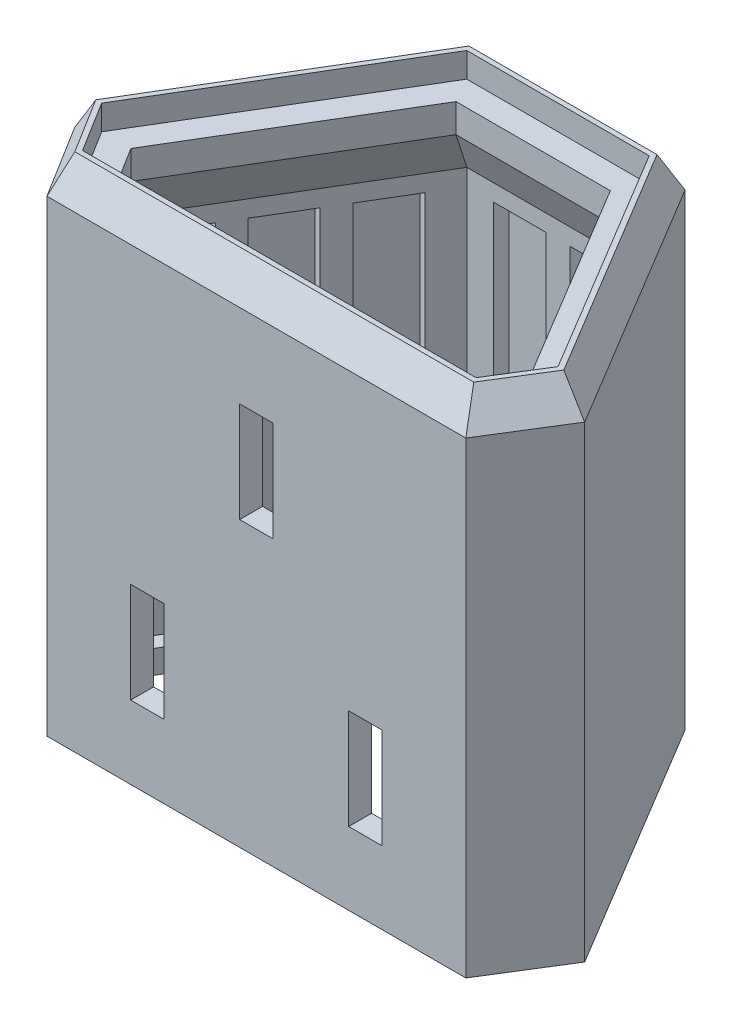
from build123d import *
from OCP.BRepFilletAPI import BRepFilletAPI_MakeChamfer

# Parameters (mm, degrees)
BOSS_EXTRUDE1_DEPTH     = 52.6
BOSS_EXTRUDE2_DEPTH     = 10.6
CUT_EXTRUDE1_DEPTH      = 2.6
CHAMFER1_SIZE           = 4
CHAMFER1_SIZE2          = 2.08
CHAMFER2_SIZE           = 2.6
CHAMFER2_SIZE_2         = 5
SKETCH4_W               = 3.5
SKETCH4_H               = 10.5
CUT_EXTRUDE2_DEPTH      = 10
CUT_EXTRUDE3_DEPTH      = 61
SKETCH7_W               = 5.5
SKETCH7_H               = 37.8
CUT_EXTRUDE4_DEPTH      = 1.6
LPATTERN1_COUNT         = 3
LPATTERN1_PITCH         = 8
LPATTERN1_COL_COUNT     = 3
LPATTERN1_COL_PITCH     = 8
BOSS_EXTRUDE4_DEPTH     = 1.6
SKETCH9_W               = 1.140450815
SKETCH9_H               = 12.988078935
BOSS_EXTRUDE5_DEPTH     = 1.6
BOSS_EXTRUDE6_DEPTH     = 1.6
SKETCH12_W              = 5.5
SKETCH12_H              = 1.257878545
BOSS_EXTRUDE7_DEPTH     = 1.6
SKETCH13_W              = 4.498542915
SKETCH13_H              = 37.8
CUT_EXTRUDE5_DEPTH      = 1.6
SKETCH14_W              = 4.344795522
SKETCH14_H              = 1.255742166
SKETCH14_W_2            = 4.359549185
SKETCH14_H_2            = 1.256348334
BOSS_EXTRUDE8_DEPTH     = 1.6
SKETCH15_W              = 4.5
SKETCH15_H              = 37.8
CUT_EXTRUDE6_DEPTH      = 1.6
SKETCH16_W              = 5.5
SKETCH16_H              = 37.8
CUT_EXTRUDE7_DEPTH      = 1.6
LPATTERN2_COUNT         = 2
LPATTERN2_PITCH         = 8
LPATTERN2_COL_COUNT     = 2
LPATTERN2_COL_PITCH     = 8
MIRROR2_COPY_1_SKETCH_W = 5.5
MIRROR2_COPY_1_SKETCH_H = 37.8
MIRROR2_COPY_1_DEPTH    = 1.6
MIRROR2_COPY_2_SKETCH_W = 5.5
MIRROR2_COPY_2_SKETCH_H = 37.8
MIRROR2_COPY_2_DEPTH    = 1.6
SKETCH17_W              = 5.5
SKETCH17_H              = 37.8
CUT_EXTRUDE8_DEPTH      = 1.6
LPATTERN3_COUNT         = 2
LPATTERN3_PITCH         = 8


with BuildPart() as part:
    # Sketch1 → Boss-Extrude1 (new body)
    with BuildSketch(Plane(origin=(0, 0, 0), x_dir=(1, 0, 0), z_dir=(0, 1, 0))):
        Polygon((-26.953018279, -2.69203799), (-22.055294719, -10.566070483), (22.055294719, -10.566070483), (26.953018279, -2.69203799), (11.028337958, 23.833929517), (-11.028337958, 23.833929517), align=None)
        Polygon((-23.906036559, -2.668005496), (-20.610589438, -7.966070483), (20.610589438, -7.966070483), (23.906036559, -2.668005496), (9.556675916, 21.233929517), (-9.556675916, 21.233929517), align=None, mode=Mode.SUBTRACT)
    extrude(amount=BOSS_EXTRUDE1_DEPTH)

    # Sketch2 → Boss-Extrude2 (add)
    with BuildSketch(Plane(origin=(0, 52.6, 0), x_dir=(1, 0, 0), z_dir=(0, 1, 0))):
        Polygon((-23.906036559, -2.668005496), (-20.610589438, -7.966070483), (20.610589438, -7.966070483), (23.906036559, -2.668005496), (9.556675916, 21.233929517), (-9.556675916, 21.233929517), align=None)
        Polygon((-20.859054838, -2.643973003), (-19.165884157, -5.366070483), (19.165884157, -5.366070483), (20.859054838, -2.643973003), (8.085013874, 18.633929517), (-8.085013874, 18.633929517), align=None, mode=Mode.SUBTRACT)
    extrude(amount=-BOSS_EXTRUDE2_DEPTH)

    # Sketch3 → Cut-Extrude1 (cut)
    with BuildSketch(Plane(origin=(0, 52.6, 0), x_dir=(1, 0, 0), z_dir=(0, 1, 0))):
        Polygon((-23.906036559, -2.668005496), (-20.610589438, -7.966070483), (20.610589438, -7.966070483), (23.906036559, -2.668005496), (9.556675916, 21.233929517), (-9.556675916, 21.233929517), align=None)
        Polygon((-20.859054838, -2.643973003), (-19.165884157, -5.366070483), (19.165884157, -5.366070483), (20.859054838, -2.643973003), (8.085013874, 18.633929517), (-8.085013874, 18.633929517), align=None, mode=Mode.SUBTRACT)
    extrude(amount=-CUT_EXTRUDE1_DEPTH, mode=Mode.SUBTRACT)

    # Chamfer1: one chamfer whose edges measure the first distance from different faces: ONE call of the kernel's chamfer builder (chamfer() names one face for all edges)
    chamfer1_edges_1 = [part.edges().sort_by_distance(p)[0] for p in [
        (-18.990678119, 52.6, -10.570945764),
    ]]
    chamfer1_side_1 = [part.faces().sort_by_distance(p)[0] for p in [
        (-18.990678119, 26.3, -10.570945764),
    ]]
    chamfer1_edges_2 = [part.edges().sort_by_distance(p)[0] for p in [
        (-24.504156499, 52.6, 6.629054236),
    ]]
    chamfer1_side_2 = [part.faces().sort_by_distance(p)[0] for p in [
        (-24.504156499, 26.3, 6.629054236),
    ]]
    chamfer1_edges_3 = [part.edges().sort_by_distance(p)[0] for p in [
        (0, 52.6, 10.566070483),
    ]]
    chamfer1_side_3 = [part.faces().sort_by_distance(p)[0] for p in [
        (0, 26.3, 10.566070483),
    ]]
    chamfer1_edges_4 = [part.edges().sort_by_distance(p)[0] for p in [
        (24.504156499, 52.6, 6.629054236),
    ]]
    chamfer1_side_4 = [part.faces().sort_by_distance(p)[0] for p in [
        (24.504156499, 26.3, 6.629054236),
    ]]
    chamfer1_edges_5 = [part.edges().sort_by_distance(p)[0] for p in [
        (18.990678119, 52.6, -10.570945764),
    ]]
    chamfer1_side_5 = [part.faces().sort_by_distance(p)[0] for p in [
        (18.990678119, 26.3, -10.570945764),
    ]]
    chamfer1_edges_6 = [part.edges().sort_by_distance(p)[0] for p in [
        (0, 52.6, -23.833929517),
    ]]
    chamfer1_side_6 = [part.faces().sort_by_distance(p)[0] for p in [
        (0, 26.3, -23.833929517),
    ]]
    chamfer1 = BRepFilletAPI_MakeChamfer(part.part.solid().wrapped)
    for e in chamfer1_edges_1:
        chamfer1.Add(CHAMFER1_SIZE, CHAMFER1_SIZE2, e.wrapped, chamfer1_side_1[0].wrapped)  # the first distance lies on this face
    for e in chamfer1_edges_2:
        chamfer1.Add(CHAMFER1_SIZE, CHAMFER1_SIZE2, e.wrapped, chamfer1_side_2[0].wrapped)  # the first distance lies on this face
    for e in chamfer1_edges_3:
        chamfer1.Add(CHAMFER1_SIZE, CHAMFER1_SIZE2, e.wrapped, chamfer1_side_3[0].wrapped)  # the first distance lies on this face
    for e in chamfer1_edges_4:
        chamfer1.Add(CHAMFER1_SIZE, CHAMFER1_SIZE2, e.wrapped, chamfer1_side_4[0].wrapped)  # the first distance lies on this face
    for e in chamfer1_edges_5:
        chamfer1.Add(CHAMFER1_SIZE, CHAMFER1_SIZE2, e.wrapped, chamfer1_side_5[0].wrapped)  # the first distance lies on this face
    for e in chamfer1_edges_6:
        chamfer1.Add(CHAMFER1_SIZE, CHAMFER1_SIZE2, e.wrapped, chamfer1_side_6[0].wrapped)  # the first distance lies on this face
    add(Compound.cast(chamfer1.Shape()), mode=Mode.REPLACE)

    # Chamfer2
    chamfer2_edges_1 = [part.edges().sort_by_distance(p)[0] for p in [
        (0, 42, -18.633929517),
    ]]
    chamfer2_side_1 = [part.faces().sort_by_distance(p)[0] for p in [
        (0, 42, -18.685929517),
    ]]
    chamfer2_edges_2 = [part.edges().sort_by_distance(p)[0] for p in [
        (-14.472034356, 42, -7.994978257),
    ]]
    chamfer2_side_2 = [part.faces().sort_by_distance(p)[0] for p in [
        (-14.516617239, 42, -8.021743281),
    ]]
    chamfer2_edges_3 = [part.edges().sort_by_distance(p)[0] for p in [
        (-20.012469497, 42, 4.005021743),
    ]]
    chamfer2_side_3 = [part.faces().sort_by_distance(p)[0] for p in [
        (-20.056624652, 42, 4.032486672),
    ]]
    chamfer2_edges_4 = [part.edges().sort_by_distance(p)[0] for p in [
        (0, 42, 5.366070483),
    ]]
    chamfer2_side_4 = [part.faces().sort_by_distance(p)[0] for p in [
        (0, 42, 5.418070483),
    ]]
    chamfer2_edges_5 = [part.edges().sort_by_distance(p)[0] for p in [
        (20.012469497, 42, 4.005021743),
    ]]
    chamfer2_side_5 = [part.faces().sort_by_distance(p)[0] for p in [
        (20.056624652, 42, 4.032486672),
    ]]
    chamfer2_edges_6 = [part.edges().sort_by_distance(p)[0] for p in [
        (14.472034356, 42, -7.994978257),
    ]]
    chamfer2_side_6 = [part.faces().sort_by_distance(p)[0] for p in [
        (14.516617239, 42, -8.021743281),
    ]]
    chamfer2 = BRepFilletAPI_MakeChamfer(part.part.solid().wrapped)
    for e in chamfer2_edges_1:
        chamfer2.Add(CHAMFER2_SIZE - 0.0001, CHAMFER2_SIZE_2 - 0.0001, e.wrapped, chamfer2_side_1[0].wrapped)
    for e in chamfer2_edges_2:
        chamfer2.Add(CHAMFER2_SIZE - 0.0001, CHAMFER2_SIZE_2 - 0.0001, e.wrapped, chamfer2_side_2[0].wrapped)
    for e in chamfer2_edges_3:
        chamfer2.Add(CHAMFER2_SIZE - 0.0001, CHAMFER2_SIZE_2 - 0.0001, e.wrapped, chamfer2_side_3[0].wrapped)
    for e in chamfer2_edges_4:
        chamfer2.Add(CHAMFER2_SIZE - 0.0001, CHAMFER2_SIZE_2 - 0.0001, e.wrapped, chamfer2_side_4[0].wrapped)
    for e in chamfer2_edges_5:
        chamfer2.Add(CHAMFER2_SIZE - 0.0001, CHAMFER2_SIZE_2 - 0.0001, e.wrapped, chamfer2_side_5[0].wrapped)
    for e in chamfer2_edges_6:
        chamfer2.Add(CHAMFER2_SIZE - 0.0001, CHAMFER2_SIZE_2 - 0.0001, e.wrapped, chamfer2_side_6[0].wrapped)
    add(Compound.cast(chamfer2.Shape()), mode=Mode.REPLACE)  # a hair under: the kernel refuses the full size

    # Sketch4 → Cut-Extrude2 (cut)
    with BuildSketch(Plane.XY.offset(10.566070483)):
        with Locations((0, 34.994195005)):
            Rectangle(SKETCH4_W, SKETCH4_H)
        with Locations((-11.42081888, 12.906843201)):
            Rectangle(SKETCH4_W, SKETCH4_H)
        with Locations((11.42081888, 12.857646379)):
            Rectangle(SKETCH4_W, SKETCH4_H)
    extrude(amount=-CUT_EXTRUDE2_DEPTH, mode=Mode.SUBTRACT)

    # Sketch6 → Cut-Extrude3 (cut)
    with BuildSketch(Plane.XZ):
        Polygon((11.028337958, -23.833929517), (26.953018279, 2.69203799), (22.055294719, 10.566070483), (-22.055294719, 10.566070483), (-26.953018279, 2.69203799), (-11.028337958, -23.833929517), align=None)
        Polygon((10.915133186, -23.633929517), (26.71863507, 2.690189336), (21.944163543, 10.366070483), (-21.944163543, 10.366070483), (-26.71863507, 2.690189336), (-10.915133186, -23.633929517), align=None, mode=Mode.SUBTRACT)
    extrude(amount=-CUT_EXTRUDE3_DEPTH, mode=Mode.SUBTRACT)

    # Sketch7 → Cut-Extrude4 (cut)
    with BuildSketch(Plane(origin=(0, 0, 7.966070483), x_dir=(-1, 0, 0), z_dir=(0, 0, -1))):
        with Locations((0.025767353, 21.344195005)):
            Rectangle(SKETCH7_W, SKETCH7_H)
    cut_extrude4 = extrude(amount=-CUT_EXTRUDE4_DEPTH, mode=Mode.SUBTRACT)

    # LPattern1: Cut-Extrude4 ×3
    with Locations(*[(-i * LPATTERN1_PITCH, 0, 0) for i in range(1, LPATTERN1_COUNT)]):
        add(cut_extrude4, mode=Mode.SUBTRACT)

    # LPattern1 col: Cut-Extrude4 ×3
    with Locations(*[(i * LPATTERN1_COL_PITCH, 0, 0) for i in range(1, LPATTERN1_COL_COUNT)]):
        add(cut_extrude4, mode=Mode.SUBTRACT)

    # Sketch8 → Boss-Extrude4 (add)
    with BuildSketch(Plane(origin=(0, 0, 9.566070483), x_dir=(-1, 0, 0), z_dir=(0, 0, -1))):
        Polygon((2.775767353, 40.244195005), (2.775767353, 28.454622031), (-2.724232647, 28.454622031), (-2.724232647, 40.244195005), (-1.75, 40.244195005), (-1.75, 29.744195005), (1.75, 29.744195005), (1.75, 40.244195005), align=None)
    extrude(amount=BOSS_EXTRUDE4_DEPTH)

    # Sketch9 → Boss-Extrude5 (add)
    with BuildSketch(Plane(origin=(0, 0, 9.566070483), x_dir=(-1, 0, 0), z_dir=(0, 0, -1))):
        Polygon((10.775767353, 18.156843201), (9.67081888, 18.156843201), (9.67081888, 7.656843201), (10.775767353, 7.656843201), (10.775767353, 6.426642811), (8.531242664, 6.426642811), (8.531242664, 19.414721746), (10.775767353, 19.414721746), align=None)
        with Locations((13.84599276, 12.920682279)):
            Rectangle(SKETCH9_W, SKETCH9_H)
    extrude(amount=BOSS_EXTRUDE5_DEPTH)

    # Sketch11 → Boss-Extrude6 (add)
    with BuildSketch(Plane(origin=(0, 0, 9.566070483), x_dir=(-1, 0, 0), z_dir=(0, 0, -1))):
        Polygon((-10.724232647, 18.107646379), (-9.67081888, 18.107646379), (-9.67081888, 7.607646379), (-10.724232647, 7.607646379), (-10.724232647, 6.426642811), (-8.566553257, 6.426642811), (-8.566553257, 19.414721746), (-10.724232647, 19.414721746), align=None)
        Polygon((-13.17081888, 18.107646379), (-13.224232647, 19.414721746), (-14.379437125, 19.414721746), (-14.379437125, 6.426642811), (-13.17081888, 6.426642811), align=None)
    extrude(amount=BOSS_EXTRUDE6_DEPTH)

    # Sketch12 → Boss-Extrude7 (add)
    with BuildSketch(Plane(origin=(0, 0, 9.566070483), x_dir=(-1, 0, 0), z_dir=(0, 0, -1))):
        with Locations((0.025767353, 18.785782473)):
            Rectangle(SKETCH12_W, SKETCH12_H)
    extrude(amount=BOSS_EXTRUDE7_DEPTH)

    # Sketch13 → Cut-Extrude5 (cut)
    with BuildSketch(Plane(origin=(18.433655639, 0, 11.465910206), x_dir=(-0.5281717070926116, 0, 0.8491375906335065), z_dir=(-0.8491375906335065, 0, -0.5281717070926116))):
        with Locations((-7.241314346, 21.344195005)):
            Rectangle(SKETCH13_W, SKETCH13_H)
    extrude(amount=-CUT_EXTRUDE5_DEPTH, mode=Mode.SUBTRACT)

    # Sketch14 → Boss-Extrude8 (add)
    with BuildSketch(Plane(origin=(0, 0, 7.966070483), x_dir=(-1, 0, 0), z_dir=(0, 0, -1))):
        with Locations((-16.551834886, 12.857646379)):
            Rectangle(SKETCH14_W, SKETCH14_H)
        with Locations((16.595992761, 12.906843201)):
            Rectangle(SKETCH14_W_2, SKETCH14_H_2)
    extrude(amount=-BOSS_EXTRUDE8_DEPTH)

    # Sketch15 → Cut-Extrude6 (cut)
    with BuildSketch(Plane(origin=(-18.433655639, 0, 11.465910206), x_dir=(-0.5281717070926114, 0, -0.8491375906335067), z_dir=(0.8491375906335068, 0, -0.5281717070926114))):
        with Locations((7.242042888, 21.344195005)):
            Rectangle(SKETCH15_W, SKETCH15_H)
    extrude(amount=-CUT_EXTRUDE6_DEPTH, mode=Mode.SUBTRACT)

    # Sketch16 → Cut-Extrude7 (cut)
    with BuildSketch(Plane(origin=(-16.39526965, 0, -9.84278624), x_dir=(0.5147120046125901, 0, -0.8573631391118287), z_dir=(0.8573631391118287, 0, 0.5147120046125901))):
        with Locations((-0.652960459, 21.344195005)):
            Rectangle(SKETCH16_W, SKETCH16_H)
    cut_extrude7 = extrude(amount=-CUT_EXTRUDE7_DEPTH, mode=Mode.SUBTRACT)

    # LPattern2: Cut-Extrude7 ×2
    with Locations(*[Vector(-0.5147120046125903, 0, 0.8573631391118287) * (i * LPATTERN2_PITCH) for i in range(1, LPATTERN2_COUNT)]):
        add(cut_extrude7, mode=Mode.SUBTRACT)

    # LPattern2 col: Cut-Extrude7 ×2
    with Locations(*[Vector(0.5147120046125899, 0, -0.8573631391118288) * (i * LPATTERN2_COL_PITCH) for i in range(1, LPATTERN2_COL_COUNT)]):
        add(cut_extrude7, mode=Mode.SUBTRACT)

    # Mirror2: Cut-Extrude7 across plane
    add(cut_extrude7.mirror(Plane(origin=(0, 0, 0), x_dir=(0, 0, 1), z_dir=(1, 0, 0))), mode=Mode.SUBTRACT)

    # Mirror2 copy 1 sketch → Mirror2 copy 1 (cut)
    with BuildSketch(Plane(origin=(20.512965687, 0, -2.983881127), x_dir=(-0.5147120046125901, 0, -0.8573631391118287), z_dir=(-0.8573631391118287, 0, 0.5147120046125901))):
        with Locations((-0.652960459, -21.344195005)):
            Rectangle(MIRROR2_COPY_1_SKETCH_W, MIRROR2_COPY_1_SKETCH_H)
    extrude(amount=-MIRROR2_COPY_1_DEPTH, mode=Mode.SUBTRACT)

    # Mirror2 copy 2 sketch → Mirror2 copy 2 (cut)
    with BuildSketch(Plane(origin=(12.277573614, 0, -16.701691352), x_dir=(-0.5147120046125901, 0, -0.8573631391118287), z_dir=(-0.8573631391118287, 0, 0.5147120046125901))):
        with Locations((-0.652960459, -21.344195005)):
            Rectangle(MIRROR2_COPY_2_SKETCH_W, MIRROR2_COPY_2_SKETCH_H)
    extrude(amount=-MIRROR2_COPY_2_DEPTH, mode=Mode.SUBTRACT)

    # Sketch17 → Cut-Extrude8 (cut)
    with BuildSketch(Plane.XY.offset(-21.233929517)):
        with Locations((4, 21.344195005)):
            Rectangle(SKETCH17_W, SKETCH17_H)
    cut_extrude8 = extrude(amount=-CUT_EXTRUDE8_DEPTH, mode=Mode.SUBTRACT)

    # LPattern3: Cut-Extrude8 ×2
    with Locations(*[(-i * LPATTERN3_PITCH, 0, 0) for i in range(1, LPATTERN3_COUNT)]):
        add(cut_extrude8, mode=Mode.SUBTRACT)


solid = part.part
